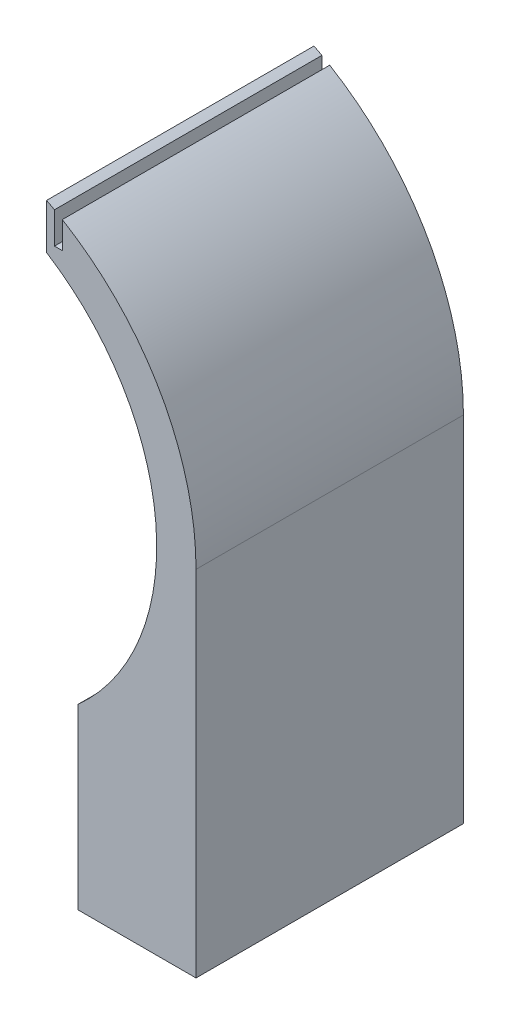
from build123d import *

# Parameters (mm, degrees)
INNER_RING_RIGHT_SIDE_DEPTH = 170


with BuildPart() as part:
    # Sketch2 → Inner Ring - Right Side (new body)
    with BuildSketch(Plane.XY):
        with BuildLine():
            Line((100, -111.803398875), (100, -225))
            Line((100, -225), (175, -225))
            Line((175, -225), (175, 0))
            ThreePointArc((175, 0), (152.274423328, 86.240941553), (90, 150.083310198))
            Line((90, 150.083310198), (90, 132.970585408))
            Line((90, 132.970585408), (85, 132.970585408))
            Line((85, 132.970585408), (85, 152.970585408))
            ThreePointArc((85, 152.970585408), (82.510826874, 154.327455265), (80, 155.643824163))
            Line((80, 155.643824163), (80, 126.885775404))
            ThreePointArc((80, 126.885775404), (149.476186998, 12.524756303), (100, -111.803398875))
        make_face()
    extrude(amount=INNER_RING_RIGHT_SIDE_DEPTH)


solid = part.part
